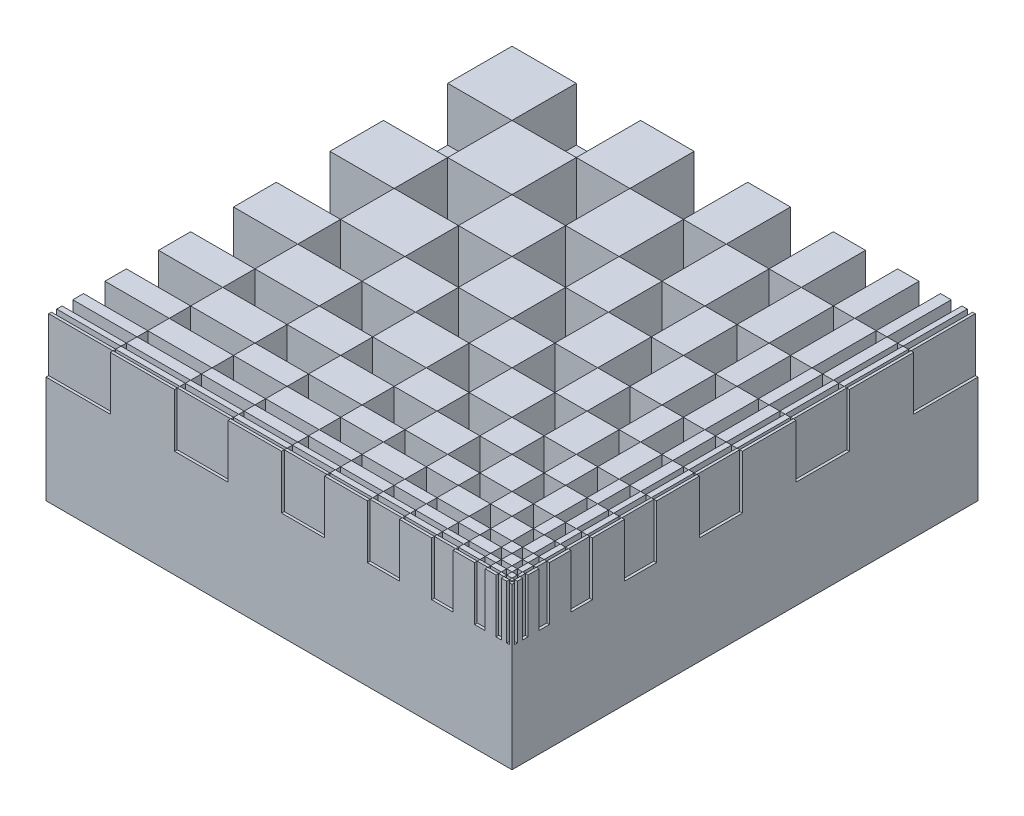
from build123d import *

# Parameters (mm, degrees)
SKETCH2_W           = 4.35
SKETCH2_H           = 4.35
BOSS_EXTRUDE1_DEPTH = 0.5
BOSS_EXTRUDE4_START = 0.5
SKETCH1_W           = 0.5
SKETCH1_H           = 0.6
SKETCH1_H_2         = 0.5
SKETCH1_W_2         = 0.4
SKETCH1_W_3         = 0.3
SKETCH1_W_4         = 0.2
SKETCH1_W_5         = 0.1
SKETCH1_W_6         = 0.05
SKETCH1_W_7         = 0.025
SKETCH1_H_3         = 0.4
SKETCH1_H_4         = 0.3
SKETCH1_H_5         = 0.2
SKETCH1_H_6         = 0.1
SKETCH1_H_7         = 0.05
SKETCH1_H_8         = 0.025
BOSS_EXTRUDE4_DEPTH = 0.5
BOSS_EXTRUDE6_START = 0.5
SKETCH1_6_W         = 0.5
SKETCH1_6_H         = 0.6
SKETCH1_6_H_2       = 0.5
SKETCH1_6_W_2       = 0.4
SKETCH1_6_W_3       = 0.3
SKETCH1_6_W_4       = 0.2
SKETCH1_6_W_5       = 0.1
SKETCH1_6_W_6       = 0.05
SKETCH1_6_W_7       = 0.025
SKETCH1_6_H_3       = 0.4
SKETCH1_6_H_4       = 0.3
SKETCH1_6_H_5       = 0.2
SKETCH1_6_H_6       = 0.1
SKETCH1_6_H_7       = 0.05
SKETCH1_6_H_8       = 0.025
BOSS_EXTRUDE6_DEPTH = 0.5
BOSS_EXTRUDE7_START = 0.5
SKETCH3_R           = 5e-05
BOSS_EXTRUDE7_DEPTH = 0.5


with BuildPart() as part:
    # Sketch2 → Boss-Extrude1 (new, symmetric)
    with BuildSketch(Plane(origin=(0, 0, 0), x_dir=(1, 0, 0), z_dir=(0, 1, 0))):
        with Locations((2.175, -2.175)):
            Rectangle(SKETCH2_W, SKETCH2_H)
    extrude(amount=BOSS_EXTRUDE1_DEPTH, both=True)

    # Sketch1 → Boss-Extrude4 (add)
    with BuildSketch(Plane(origin=(0, 0, 0), x_dir=(1, 0, 0), z_dir=(0, 1, 0)).offset(BOSS_EXTRUDE4_START)):
        with Locations((1.45, -0.3)):
            Rectangle(SKETCH1_W, SKETCH1_H)
        Polygon((0.6, 0), (0, 0), (0.6, -0.6), align=None)
        Polygon((0.6, -0.6), (0, 0), (0, -0.6), align=None)
        with Locations((1.45, -1.45)):
            Rectangle(SKETCH1_W, SKETCH1_H_2)
        with Locations((2.4, -1.45)):
            Rectangle(SKETCH1_W_2, SKETCH1_H_2)
        with Locations((2.4, -0.3)):
            Rectangle(SKETCH1_W_2, SKETCH1_H)
        with Locations((3.15, -0.3)):
            Rectangle(SKETCH1_W_3, SKETCH1_H)
        with Locations((3.15, -1.45)):
            Rectangle(SKETCH1_W_3, SKETCH1_H_2)
        with Locations((3.7, -1.45)):
            Rectangle(SKETCH1_W_4, SKETCH1_H_2)
        with Locations((3.7, -0.3)):
            Rectangle(SKETCH1_W_4, SKETCH1_H)
        with Locations((4.05, -0.3)):
            Rectangle(SKETCH1_W_5, SKETCH1_H)
        with Locations((4.05, -1.45)):
            Rectangle(SKETCH1_W_5, SKETCH1_H_2)
        with Locations((4.225, -0.3)):
            Rectangle(SKETCH1_W_6, SKETCH1_H)
        with Locations((4.3125, -0.3)):
            Rectangle(SKETCH1_W_7, SKETCH1_H)
        with Locations((4.225, -1.45)):
            Rectangle(SKETCH1_W_6, SKETCH1_H_2)
        with Locations((4.3125, -1.45)):
            Rectangle(SKETCH1_W_7, SKETCH1_H_2)
        with Locations((2.4, -2.4)):
            Rectangle(SKETCH1_W_2, SKETCH1_H_3)
        with Locations((3.15, -3.15)):
            Rectangle(SKETCH1_W_3, SKETCH1_H_4)
        with Locations((3.7, -3.7)):
            Rectangle(SKETCH1_W_4, SKETCH1_H_5)
        with Locations((3.15, -2.4)):
            Rectangle(SKETCH1_W_3, SKETCH1_H_3)
        with Locations((3.7, -2.4)):
            Rectangle(SKETCH1_W_4, SKETCH1_H_3)
        with Locations((3.7, -3.15)):
            Rectangle(SKETCH1_W_4, SKETCH1_H_4)
        with Locations((4.05, -3.15)):
            Rectangle(SKETCH1_W_5, SKETCH1_H_4)
        with Locations((4.05, -2.4)):
            Rectangle(SKETCH1_W_5, SKETCH1_H_3)
        with Locations((4.225, -2.4)):
            Rectangle(SKETCH1_W_6, SKETCH1_H_3)
        with Locations((4.225, -3.15)):
            Rectangle(SKETCH1_W_6, SKETCH1_H_4)
        with Locations((4.05, -3.7)):
            Rectangle(SKETCH1_W_5, SKETCH1_H_5)
        with Locations((4.225, -3.7)):
            Rectangle(SKETCH1_W_6, SKETCH1_H_5)
        with Locations((4.3125, -2.4)):
            Rectangle(SKETCH1_W_7, SKETCH1_H_3)
        with Locations((4.3125, -3.15)):
            Rectangle(SKETCH1_W_7, SKETCH1_H_4)
        with Locations((4.3125, -3.7)):
            Rectangle(SKETCH1_W_7, SKETCH1_H_5)
        with Locations((4.05, -4.05)):
            Rectangle(SKETCH1_W_5, SKETCH1_H_6)
        with Locations((4.225, -4.05)):
            Rectangle(SKETCH1_W_6, SKETCH1_H_6)
        with Locations((4.225, -4.225)):
            Rectangle(SKETCH1_W_6, SKETCH1_H_7)
        with Locations((4.3125, -4.05)):
            Rectangle(SKETCH1_W_7, SKETCH1_H_6)
        with Locations((4.3125, -4.225)):
            Rectangle(SKETCH1_W_7, SKETCH1_H_7)
        with Locations((4.3125, -4.3125)):
            Rectangle(SKETCH1_W_7, SKETCH1_H_8)
    extrude(amount=BOSS_EXTRUDE4_DEPTH)



with BuildPart() as body_2:
    # Sketch1<6> → Boss-Extrude6 (new body)
    with BuildSketch(Plane(origin=(0, 0, 0), x_dir=(1, 0, 0), z_dir=(0, 1, 0)).offset(BOSS_EXTRUDE6_START)):
        Polygon((1.2, -0.6), (0.6, -0.6), (1.2, -1.2), align=None)
        Polygon((1.2, -1.2), (0.6, -0.6), (0.6, -1.2), align=None)
        with Locations((1.95, -0.9)):
            Rectangle(SKETCH1_6_W, SKETCH1_6_H)
        with Locations((1.95, -1.95)):
            Rectangle(SKETCH1_6_W, SKETCH1_6_H_2)
        with Locations((2.8, -1.95)):
            Rectangle(SKETCH1_6_W_2, SKETCH1_6_H_2)
        with Locations((2.8, -0.9)):
            Rectangle(SKETCH1_6_W_2, SKETCH1_6_H)
        with Locations((3.45, -0.9)):
            Rectangle(SKETCH1_6_W_3, SKETCH1_6_H)
        with Locations((3.45, -1.95)):
            Rectangle(SKETCH1_6_W_3, SKETCH1_6_H_2)
        with Locations((3.9, -1.95)):
            Rectangle(SKETCH1_6_W_4, SKETCH1_6_H_2)
        with Locations((3.9, -0.9)):
            Rectangle(SKETCH1_6_W_4, SKETCH1_6_H)
        with Locations((4.15, -0.9)):
            Rectangle(SKETCH1_6_W_5, SKETCH1_6_H)
        with Locations((4.275, -0.9)):
            Rectangle(SKETCH1_6_W_6, SKETCH1_6_H)
        with Locations((4.3375, -0.9)):
            Rectangle(SKETCH1_6_W_7, SKETCH1_6_H)
        with Locations((4.15, -1.95)):
            Rectangle(SKETCH1_6_W_5, SKETCH1_6_H_2)
        with Locations((4.275, -1.95)):
            Rectangle(SKETCH1_6_W_6, SKETCH1_6_H_2)
        with Locations((4.3375, -1.95)):
            Rectangle(SKETCH1_6_W_7, SKETCH1_6_H_2)
        with Locations((4.3375, -2.8)):
            Rectangle(SKETCH1_6_W_7, SKETCH1_6_H_3)
        with Locations((4.275, -2.8)):
            Rectangle(SKETCH1_6_W_6, SKETCH1_6_H_3)
        with Locations((4.15, -2.8)):
            Rectangle(SKETCH1_6_W_5, SKETCH1_6_H_3)
        with Locations((3.9, -2.8)):
            Rectangle(SKETCH1_6_W_4, SKETCH1_6_H_3)
        with Locations((3.45, -2.8)):
            Rectangle(SKETCH1_6_W_3, SKETCH1_6_H_3)
        with Locations((2.8, -2.8)):
            Rectangle(SKETCH1_6_W_2, SKETCH1_6_H_3)
        with Locations((3.45, -3.45)):
            Rectangle(SKETCH1_6_W_3, SKETCH1_6_H_4)
        with Locations((3.9, -3.45)):
            Rectangle(SKETCH1_6_W_4, SKETCH1_6_H_4)
        with Locations((3.9, -3.9)):
            Rectangle(SKETCH1_6_W_4, SKETCH1_6_H_5)
        with Locations((4.15, -3.9)):
            Rectangle(SKETCH1_6_W_5, SKETCH1_6_H_5)
        with Locations((4.15, -3.45)):
            Rectangle(SKETCH1_6_W_5, SKETCH1_6_H_4)
        with Locations((4.275, -3.45)):
            Rectangle(SKETCH1_6_W_6, SKETCH1_6_H_4)
        with Locations((4.275, -3.9)):
            Rectangle(SKETCH1_6_W_6, SKETCH1_6_H_5)
        with Locations((4.3375, -3.45)):
            Rectangle(SKETCH1_6_W_7, SKETCH1_6_H_4)
        with Locations((4.3375, -3.9)):
            Rectangle(SKETCH1_6_W_7, SKETCH1_6_H_5)
        with Locations((4.15, -4.15)):
            Rectangle(SKETCH1_6_W_5, SKETCH1_6_H_6)
        with Locations((4.275, -4.15)):
            Rectangle(SKETCH1_6_W_6, SKETCH1_6_H_6)
        with Locations((4.275, -4.275)):
            Rectangle(SKETCH1_6_W_6, SKETCH1_6_H_7)
        with Locations((4.3375, -4.275)):
            Rectangle(SKETCH1_6_W_7, SKETCH1_6_H_7)
        with Locations((4.3375, -4.15)):
            Rectangle(SKETCH1_6_W_7, SKETCH1_6_H_6)
        with Locations((4.3375, -4.3375)):
            Rectangle(SKETCH1_6_W_7, SKETCH1_6_H_8)
    extrude(amount=BOSS_EXTRUDE6_DEPTH)


with BuildPart() as part_1:
    add(part.part)

    add(body_2.part)  # Boss-Extrude7 merges body 2
    # Sketch3 → Boss-Extrude7 (add)
    with BuildSketch(Plane(origin=(0, 0, 0), x_dir=(1, 0, 0), z_dir=(0, 1, 0)).offset(BOSS_EXTRUDE7_START)):
        with Locations((0.6, -0.6)):
            Circle(SKETCH3_R)
        with Locations((1.2, -0.6)):
            Circle(SKETCH3_R)
        with Locations((1.2, -1.2)):
            Circle(SKETCH3_R)
        with Locations((1.7, -1.2)):
            Circle(SKETCH3_R)
        with Locations((1.7, -1.7)):
            Circle(SKETCH3_R)
        with Locations((1.7, -0.6)):
            Circle(SKETCH3_R)
        with Locations((2.2, -0.6)):
            Circle(SKETCH3_R)
        with Locations((2.6, -0.6)):
            Circle(SKETCH3_R)
        with Locations((3, -0.6)):
            Circle(SKETCH3_R)
        with Locations((3.3, -0.6)):
            Circle(SKETCH3_R)
        with Locations((3.6, -0.6)):
            Circle(SKETCH3_R)
        with Locations((3.8, -0.6)):
            Circle(SKETCH3_R)
        with Locations((4, -0.6)):
            Circle(SKETCH3_R)
        with Locations((4.1, -0.6)):
            Circle(SKETCH3_R)
        with Locations((4.2, -0.6)):
            Circle(SKETCH3_R)
        with Locations((4.25, -0.6)):
            Circle(SKETCH3_R)
        with Locations((4.3, -0.6)):
            Circle(SKETCH3_R)
        with Locations((4.325, -0.6)):
            Circle(SKETCH3_R)
        with Locations((4.325, -1.2)):
            Circle(SKETCH3_R)
        with Locations((4.3, -1.2)):
            Circle(SKETCH3_R)
        with Locations((4.25, -1.2)):
            Circle(SKETCH3_R)
        with Locations((4.2, -1.2)):
            Circle(SKETCH3_R)
        with Locations((4.1, -1.2)):
            Circle(SKETCH3_R)
        with Locations((4, -1.2)):
            Circle(SKETCH3_R)
        with Locations((3.8, -1.2)):
            Circle(SKETCH3_R)
        with Locations((3.6, -1.2)):
            Circle(SKETCH3_R)
        with Locations((2.2, -1.2)):
            Circle(SKETCH3_R)
        with Locations((2.6, -1.2)):
            Circle(SKETCH3_R)
        with Locations((3, -1.2)):
            Circle(SKETCH3_R)
        with Locations((3.3, -1.2)):
            Circle(SKETCH3_R)
        with Locations((2.2, -1.7)):
            Circle(SKETCH3_R)
        with Locations((2.6, -1.7)):
            Circle(SKETCH3_R)
        with Locations((3, -1.7)):
            Circle(SKETCH3_R)
        with Locations((3.3, -1.7)):
            Circle(SKETCH3_R)
        with Locations((3.6, -1.7)):
            Circle(SKETCH3_R)
        with Locations((3.8, -1.7)):
            Circle(SKETCH3_R)
        with Locations((4, -1.7)):
            Circle(SKETCH3_R)
        with Locations((4.1, -1.7)):
            Circle(SKETCH3_R)
        with Locations((4.2, -1.7)):
            Circle(SKETCH3_R)
        with Locations((4.25, -1.7)):
            Circle(SKETCH3_R)
        with Locations((4.3, -1.7)):
            Circle(SKETCH3_R)
        with Locations((4.325, -1.7)):
            Circle(SKETCH3_R)
        with Locations((2.2, -2.2)):
            Circle(SKETCH3_R)
        with Locations((2.6, -2.2)):
            Circle(SKETCH3_R)
        with Locations((2.6, -2.6)):
            Circle(SKETCH3_R)
        with Locations((3, -2.6)):
            Circle(SKETCH3_R)
        with Locations((3, -2.2)):
            Circle(SKETCH3_R)
        with Locations((3.3, -2.2)):
            Circle(SKETCH3_R)
        with Locations((3.6, -2.2)):
            Circle(SKETCH3_R)
        with Locations((3.8, -2.2)):
            Circle(SKETCH3_R)
        with Locations((3.6, -2.6)):
            Circle(SKETCH3_R)
        with Locations((3.3, -2.6)):
            Circle(SKETCH3_R)
        with Locations((3.3, -3)):
            Circle(SKETCH3_R)
        with Locations((3, -3)):
            Circle(SKETCH3_R)
        with Locations((3.3, -3.3)):
            Circle(SKETCH3_R)
        with Locations((3.6, -3)):
            Circle(SKETCH3_R)
        with Locations((3.6, -3.3)):
            Circle(SKETCH3_R)
        with Locations((3.6, -3.6)):
            Circle(SKETCH3_R)
        with Locations((3.8, -3.6)):
            Circle(SKETCH3_R)
        with Locations((3.8, -3.8)):
            Circle(SKETCH3_R)
        with Locations((3.8, -2.6)):
            Circle(SKETCH3_R)
        with Locations((3.8, -3)):
            Circle(SKETCH3_R)
        with Locations((3.8, -3.3)):
            Circle(SKETCH3_R)
        with Locations((4, -2.2)):
            Circle(SKETCH3_R)
        with Locations((4, -2.6)):
            Circle(SKETCH3_R)
        with Locations((4, -3)):
            Circle(SKETCH3_R)
        with Locations((4, -3.3)):
            Circle(SKETCH3_R)
        with Locations((4, -3.6)):
            Circle(SKETCH3_R)
        with Locations((4, -3.8)):
            Circle(SKETCH3_R)
        with Locations((4, -4)):
            Circle(SKETCH3_R)
        with Locations((4.2, -2.2)):
            Circle(SKETCH3_R)
        with Locations((4.25, -2.2)):
            Circle(SKETCH3_R)
        with Locations((4.3, -2.2)):
            Circle(SKETCH3_R)
        with Locations((4.325, -2.2)):
            Circle(SKETCH3_R)
        with Locations((4.1, -2.2)):
            Circle(SKETCH3_R)
        with Locations((4.1, -2.6)):
            Circle(SKETCH3_R)
        with Locations((4.2, -2.6)):
            Circle(SKETCH3_R)
        with Locations((4.25, -2.6)):
            Circle(SKETCH3_R)
        with Locations((4.3, -2.6)):
            Circle(SKETCH3_R)
        with Locations((4.325, -2.6)):
            Circle(SKETCH3_R)
        with Locations((4.325, -3)):
            Circle(SKETCH3_R)
        with Locations((4.3, -3)):
            Circle(SKETCH3_R)
        with Locations((4.25, -3)):
            Circle(SKETCH3_R)
        with Locations((4.2, -3)):
            Circle(SKETCH3_R)
        with Locations((4.2, -3.3)):
            Circle(SKETCH3_R)
        with Locations((4.1, -3)):
            Circle(SKETCH3_R)
        with Locations((4.1, -3.3)):
            Circle(SKETCH3_R)
        with Locations((4.25, -3.3)):
            Circle(SKETCH3_R)
        with Locations((4.3, -3.3)):
            Circle(SKETCH3_R)
        with Locations((4.325, -3.3)):
            Circle(SKETCH3_R)
        with Locations((4.1, -3.6)):
            Circle(SKETCH3_R)
        with Locations((4.2, -3.6)):
            Circle(SKETCH3_R)
        with Locations((4.25, -3.6)):
            Circle(SKETCH3_R)
        with Locations((4.3, -3.6)):
            Circle(SKETCH3_R)
        with Locations((4.325, -3.6)):
            Circle(SKETCH3_R)
        with Locations((4.325, -3.8)):
            Circle(SKETCH3_R)
        with Locations((4.3, -3.8)):
            Circle(SKETCH3_R)
        with Locations((4.25, -3.8)):
            Circle(SKETCH3_R)
        with Locations((4.2, -3.8)):
            Circle(SKETCH3_R)
        with Locations((4.1, -3.8)):
            Circle(SKETCH3_R)
        with Locations((4.1, -4)):
            Circle(SKETCH3_R)
        with Locations((4.2, -4)):
            Circle(SKETCH3_R)
        with Locations((4.25, -4)):
            Circle(SKETCH3_R)
        with Locations((4.3, -4)):
            Circle(SKETCH3_R)
        with Locations((4.325, -4)):
            Circle(SKETCH3_R)
        with Locations((4.325, -4.1)):
            Circle(SKETCH3_R)
        with Locations((4.3, -4.1)):
            Circle(SKETCH3_R)
        with Locations((4.25, -4.1)):
            Circle(SKETCH3_R)
        with Locations((4.2, -4.1)):
            Circle(SKETCH3_R)
        with Locations((4.1, -4.1)):
            Circle(SKETCH3_R)
        with Locations((4.2, -4.2)):
            Circle(SKETCH3_R)
        with Locations((4.25, -4.2)):
            Circle(SKETCH3_R)
        with Locations((4.3, -4.2)):
            Circle(SKETCH3_R)
        with Locations((4.325, -4.2)):
            Circle(SKETCH3_R)
        with Locations((4.325, -4.25)):
            Circle(SKETCH3_R)
        with Locations((4.3, -4.25)):
            Circle(SKETCH3_R)
        with Locations((4.325, -4.3)):
            Circle(SKETCH3_R)
        with Locations((4.3, -4.3)):
            Circle(SKETCH3_R)
        with Locations((4.325, -4.325)):
            Circle(SKETCH3_R)
        with Locations((4.25, -4.25)):
            Circle(SKETCH3_R)
    extrude(amount=BOSS_EXTRUDE7_DEPTH)

    # Mirror10: part across plane


with BuildPart() as part_2:
    add(part_1.part)
    add(part_1.part.mirror(Plane(origin=(0, 0, 0), x_dir=(0.7071067811865476, 0, 0.7071067811865475), z_dir=(-0.7071067811865475, 0, 0.7071067811865476))))


solid = part_2.part
